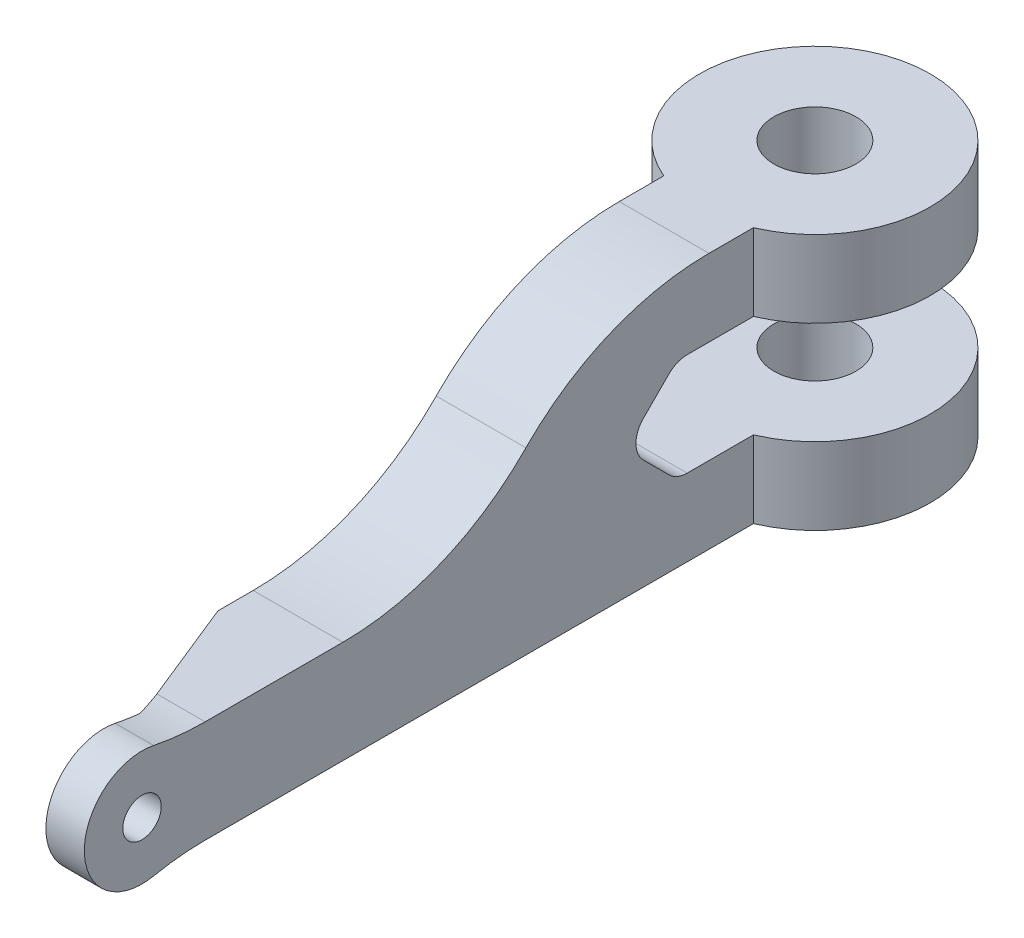
from build123d import *

# Parameters (mm, degrees)
SKETCH4_R           = 4.5
SKETCH4_R_2         = 1.6
BOSS_EXTRUDE3_DEPTH = 3
BOSS_EXTRUDE4_START = 4
SKETCH5_R           = 4.5
SKETCH5_R_2         = 1.6
BOSS_EXTRUDE4_DEPTH = 3
BOSS_EXTRUDE5_START = -10
BOSS_EXTRUDE5_DEPTH = 10
CUT_EXTRUDE1_DEPTH  = 17.126453423
SKETCH8_W           = 3.5
SKETCH8_H           = 4
BOSS_EXTRUDE6_DEPTH = 17
SKETCH9_R           = 0.75
CUT_EXTRUDE2_DEPTH  = 31.381943651
SKETCH10_R          = 2.25
SKETCH10_R_2        = 0.75
BOSS_EXTRUDE7_DEPTH = 1.5
FILLET1_R           = 10
FILLET2_R           = 10
FILLET3_R           = 1
SKETCH11_W          = 2
SKETCH11_H          = 2.46221445
CUT_EXTRUDE3_DEPTH  = 33.176272314
CHAMFER2_SIZE       = 4
CHAMFER2_SIZE2      = 1.616104903
CHAMFER3_SIZE       = 0.38
CHAMFER3_SIZE_2     = 1.044041419


with BuildPart() as part:
    # Sketch4 → Boss-Extrude3 (new body)
    with BuildSketch(Plane(origin=(0, 0, 0), x_dir=(1, 0, 0), z_dir=(0, 1, 0))):
        with Locations(Location((0, 0, 0), (0, 0, 270))):
            Circle(SKETCH4_R)
        with Locations(Location((0, 0, 0), (0, 0, 270))):
            Circle(SKETCH4_R_2, mode=Mode.SUBTRACT)
    extrude(amount=BOSS_EXTRUDE3_DEPTH)



with BuildPart() as body_2:
    # Sketch5 → Boss-Extrude4 (new body)
    with BuildSketch(Plane(origin=(0, 3, 0), x_dir=(1, 0, 0), z_dir=(0, 1, 0)).offset(BOSS_EXTRUDE4_START)):
        with Locations(Location((0, 0, 0), (0, 0, 270))):
            Circle(SKETCH5_R)
        with Locations(Location((0, 0, 0), (0, 0, 270))):
            Circle(SKETCH5_R_2, mode=Mode.SUBTRACT)
    extrude(amount=BOSS_EXTRUDE4_DEPTH)


with BuildPart() as part_1:
    add(part.part)

    add(body_2.part)  # Boss-Extrude5 merges body 2
    # Sketch6 → Boss-Extrude5 (add)
    with BuildSketch(Plane(origin=(0, 10, 0), x_dir=(1, 0, 0), z_dir=(0, 1, 0)).offset(BOSS_EXTRUDE5_START)):
        with BuildLine():
            ThreePointArc((1.75, -4.145780988), (0, -4.5), (-1.75, -4.145780988))
            Line((-1.75, -4.145780988), (-1.75, -11))
            Line((-1.75, -11), (1.75, -11))
            Line((1.75, -11), (1.75, -4.145780988))
        make_face()
    extrude(amount=BOSS_EXTRUDE5_DEPTH)

    # Sketch7 → Cut-Extrude1 (cut, through all)
    with BuildSketch(Plane.ZY.offset(1.75)):
        Polygon((4.145780988, 7), (4.145780988, 3), (7.145780988, 3), (9.145780988, 5), (7.145780988, 7), align=None)
    extrude(amount=-CUT_EXTRUDE1_DEPTH, mode=Mode.SUBTRACT)

    # Sketch8 → Boss-Extrude6 (add)
    with BuildSketch(Plane.XY.offset(11)):
        with Locations((0, 2)):
            Rectangle(SKETCH8_W, SKETCH8_H)
    extrude(amount=BOSS_EXTRUDE6_DEPTH)

    # Sketch9 → Cut-Extrude2 (cut, through all)
    with BuildSketch(Plane(origin=(1.75, 0, 0), x_dir=(0, 0, -1), z_dir=(1, 0, 0))):
        with Locations((-28, 2)):
            Circle(SKETCH9_R)
    extrude(amount=-CUT_EXTRUDE2_DEPTH, mode=Mode.SUBTRACT)

    # Sketch10 → Boss-Extrude7 (add)
    with BuildSketch(Plane(origin=(1.75, 0, 0), x_dir=(0, 0, -1), z_dir=(1, 0, 0))):
        with Locations((-28, 2)):
            Circle(SKETCH10_R)
        with Locations((-28, 2)):
            Circle(SKETCH10_R_2, mode=Mode.SUBTRACT)
    extrude(amount=-BOSS_EXTRUDE7_DEPTH)

    # Fillet1
    # the kernel refuses this fillet: 10 mm, written as the material it adds along each edge
    with BuildSketch(Plane(origin=(1.75, 4, 11), x_dir=(0, 1, 0), z_dir=(-1, 0, 0))) as fillet1_piece_1:
        with BuildLine():
            CenterArc((10, -9.16515139), FILLET1_R, 113.578178478, 66.421821522)
            Line((0, -9.16515139), (0, 0))
            Line((0, 0), (6, 0))
        make_face()
    extrude(amount=3.5)
    with BuildSketch(Plane(origin=(0.25, 4, 26.969223594), x_dir=(0, 0, -1), z_dir=(1, 0, 0))) as fillet1_piece_2:
        with BuildLine():
            CenterArc((1.431438044, 10), FILLET1_R, 258.404727341, 11.595272659)
            ThreePointArc((-0.578532936, 0.204081633), (-0.282278366, 0.121850768), (0, 0))
            Line((0, 0), (1.431438044, 0))
        make_face()
    extrude(amount=1.5)
    with BuildSketch(Plane(origin=(0.25, 0, 26.969223594), x_dir=(0, -0.33266579589081224, 0.9430447859165186), z_dir=(1, 0, 0))) as fillet1_piece_3:
        with BuildLine():
            CenterArc((1.976747775, 9.906638335), FILLET1_R, 250.569341445, 11.595272659)
            Line((-1.349910184, 0.476190476), (0, 0))
            ThreePointArc((0, 0), (0.306736724, 0.021006375), (0.613473447, 0))
        make_face()
    extrude(amount=1.5)

    # Fillet2
    fillet2_edges = [part_1.edges().sort_by_distance(p)[0] for p in [
        (0, 10, 11),
    ]]
    fillet(fillet2_edges, radius=FILLET2_R)

    # Fillet3
    fillet3_edges = [part_1.edges().sort_by_distance(p)[0] for p in [
        (0, 7, 7.145780988),
        (0, 5, 9.145780988),
        (0, 3, 7.145780988),
    ]]
    fillet(fillet3_edges, radius=FILLET3_R)

    # Sketch11 → Cut-Extrude3 (cut, through all)
    with BuildSketch(Plane.XZ):
        with Locations((-0.75, 26.768892775)):
            Rectangle(SKETCH11_W, SKETCH11_H)
    extrude(amount=-CUT_EXTRUDE3_DEPTH, mode=Mode.SUBTRACT)

    # Chamfer2
    chamfer2_edges = [part_1.edges().sort_by_distance(p)[0] for p in [
        (-1.75, 2, 25.53778555),
    ]]
    chamfer2_side = [part_1.faces().sort_by_distance(p)[0] for p in [
        (-1.75, 3.550024841, 13.432455859),
    ]]
    chamfer(chamfer2_edges, length=CHAMFER2_SIZE, length2=CHAMFER2_SIZE2, reference=chamfer2_side[0])

    # Chamfer3
    # the kernel refuses this chamfer: 1.044041419, 0.38 mm, written as the material it adds along each edge
    with BuildSketch(Plane(origin=(0.25, -2.708446751, 25.53778555), x_dir=(-0.9950833631817484, 0, -0.09904090225205131), z_dir=(0, 1, 0))) as chamfer3_piece_1_section:
        Polygon((CHAMFER3_SIZE * 0.995083363182, CHAMFER3_SIZE * 0.0990409022521), (-CHAMFER3_SIZE_2 * 0.0990409022893, CHAMFER3_SIZE_2 * 0.995083363556), (0, 0), align=None)
    chamfer3_piece_1 = extrude(amount=9.416893502, mode=Mode.PRIVATE)
    chamfer3_piece_1 = chamfer3_piece_1 - Plane(origin=(0.195523629, 14, 25.53778555), x_dir=(0, 0, -1), z_dir=(-1, 0, 0)) * Cylinder(10, 23, mode=Mode.PRIVATE)
    chamfer3_piece_1 = chamfer3_piece_1 - Plane(origin=(0.195523629, -10, 25.53778555), x_dir=(0, -0.3326657958908282, 0.943044785916513), z_dir=(-1, 0, 0)) * Cylinder(10, 23, mode=Mode.PRIVATE)
    add(chamfer3_piece_1)


solid = part_1.part
